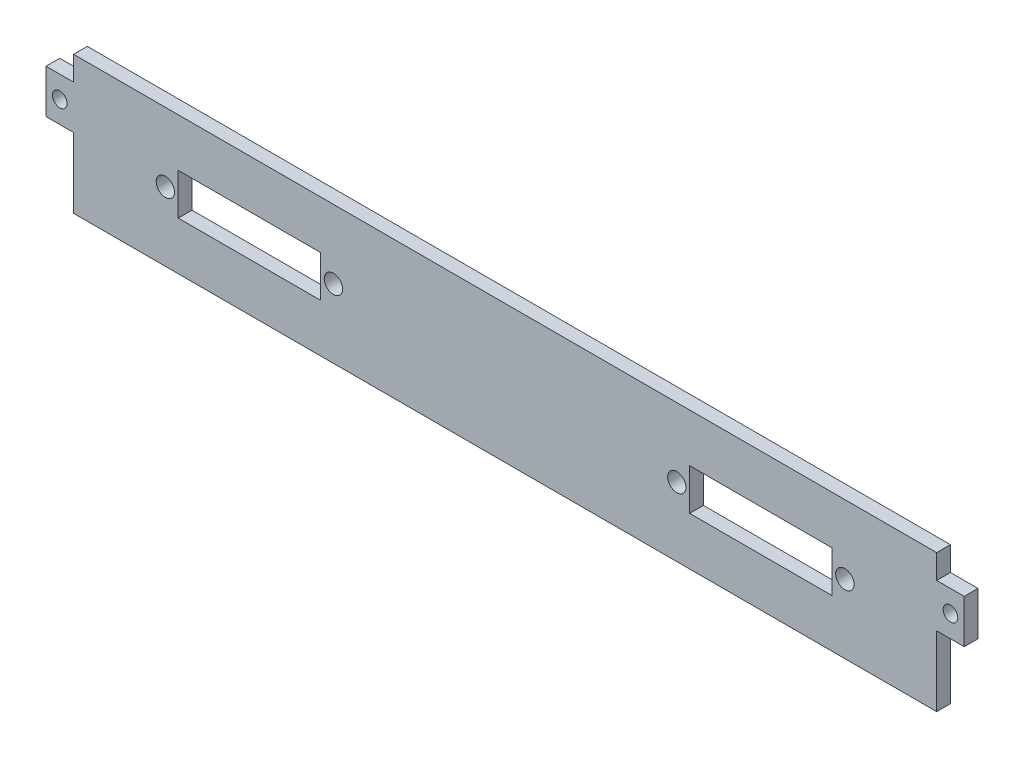
from build123d import *

# Parameters (mm, degrees)
ESBO_O1_R                = 1.6
ESBO_O1_R_2              = 2
ESBO_O1_W                = 31
ESBO_O1_H                = 9
RESSALTO_EXTRUS_O1_DEPTH = 3


with BuildPart() as part:
    # Esboço1 → Ressalto-extrusão1 (new body)
    with BuildSketch(Plane.XY):
        Polygon((-94, 0.25), (-94, -15), (94, -15), (94, 0.25), (100, 0.25), (100, 9.75), (94, 9.75), (94, 15), (-94, 15), (-94, 9.75), (-100, 9.75), (-100, 0.25), align=None)
        with Locations((-97, 5)):
            Circle(ESBO_O1_R, mode=Mode.SUBTRACT)
        with Locations((97, 5)):
            Circle(ESBO_O1_R, mode=Mode.SUBTRACT)
        with Locations((-74, 0)):
            Circle(ESBO_O1_R_2, mode=Mode.SUBTRACT)
        with Locations((-37.4, 0)):
            Circle(ESBO_O1_R_2, mode=Mode.SUBTRACT)
        with Locations((37.4, 0)):
            Circle(ESBO_O1_R_2, mode=Mode.SUBTRACT)
        with Locations((74, 0)):
            Circle(ESBO_O1_R_2, mode=Mode.SUBTRACT)
        with Locations((-55.7, 0)):
            Rectangle(ESBO_O1_W, ESBO_O1_H, mode=Mode.SUBTRACT)
        with Locations((55.7, 0)):
            Rectangle(ESBO_O1_W, ESBO_O1_H, mode=Mode.SUBTRACT)
    extrude(amount=RESSALTO_EXTRUS_O1_DEPTH)


solid = part.part
